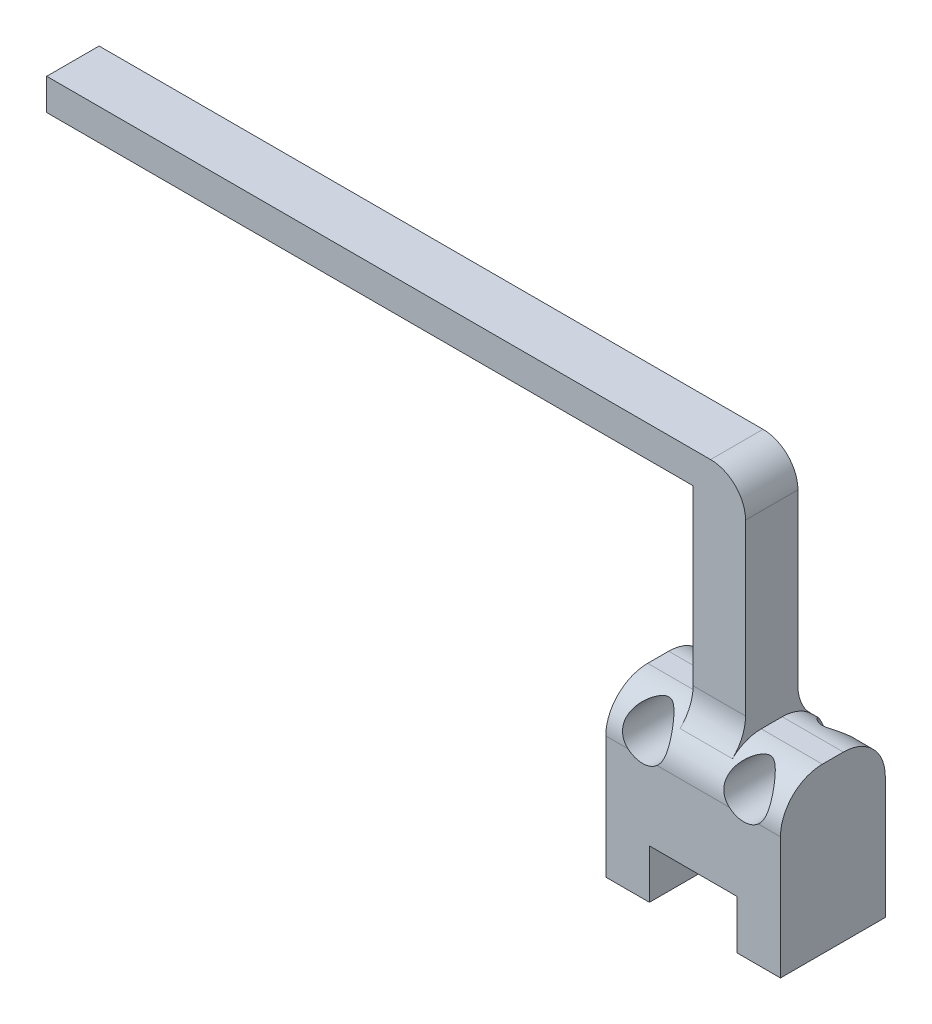
from build123d import *

# Parameters (mm, degrees)
SKETCH1_R           = 3.175
PUSHER_BASE_DEPTH   = 15
SKETCH3_R           = 1.95
SCREW_HOLE_DEPTH    = 7.5
SKETCH6_W           = 7.5
SKETCH6_H           = 32
PUSHER_HEAD_DEPTH   = 3.75
FILLET1_R           = 6
FILLET5_R           = 6
FILLET6_R           = 6
SKETCH8_W           = 92.5
SKETCH8_H           = 4.5
BOSS_EXTRUDE1_DEPTH = 7.5
FILLET7_R           = 5


with BuildPart() as part:
    # Sketch1 → pusher base (new body)
    with BuildSketch(Plane.XY):
        Polygon((59.166899441, -45.781018283), (51.666899441, -45.781018283), (41.666899441, -45.781018283), (34.166899441, -45.781018283), (34.166899441, -69.281018283), (40.416899441, -69.281018283), (40.416899441, -62.281018283), (52.916899441, -62.281018283), (52.916899441, -69.281018283), (59.166899441, -69.281018283), align=None)
        with Locations((39.416899441, -49.381018283)):
            Circle(SKETCH1_R, mode=Mode.SUBTRACT)
        with Locations((53.916899441, -49.381018283)):
            Circle(SKETCH1_R, mode=Mode.SUBTRACT)
    extrude(amount=PUSHER_BASE_DEPTH)

    # Sketch3 → screw hole (cut)
    with BuildSketch(Plane.XZ.offset(62.281018283)):
        with Locations(Location((46.666899441, 7.5, 0), (0, 0, 270))):
            Circle(SKETCH3_R)
    extrude(amount=-SCREW_HOLE_DEPTH, mode=Mode.SUBTRACT)

    # Sketch6 → pusher head (add, symmetric)
    with BuildSketch(Plane.XY.offset(7.5)):
        with Locations((46.666899441, -29.781018283)):
            Rectangle(SKETCH6_W, SKETCH6_H)
    extrude(amount=PUSHER_HEAD_DEPTH, both=True)

    # Fillet1
    # the kernel refuses this fillet: 6 mm, written as the material it takes off along each edge
    with BuildSketch(Plane(origin=(74.166899441, -45.781018283, 0), x_dir=(0, 0, 1), z_dir=(-1, 0, 0))) as fillet1_piece_1_section:
        with BuildLine():
            CenterArc((FILLET1_R, -FILLET1_R), FILLET1_R, 90, 90)
            Line((0, -FILLET1_R), (0, 0))
            Line((0, 0), (FILLET1_R, 0))
        make_face()
    fillet1_piece_1 = extrude(amount=55, mode=Mode.PRIVATE)
    fillet1_piece_1 = split(fillet1_piece_1, bisect_by=Plane(origin=(62.291899441, -45.824840722, 3.75), z_dir=(0, 0, 1)), keep=Keep.TOP, mode=Mode.PRIVATE)
    fillet1_piece_1 = split(fillet1_piece_1, bisect_by=Plane(origin=(50.416899441, -45.824840722, 4.566140917), z_dir=(1, 0, 0)), keep=Keep.TOP, mode=Mode.PRIVATE)
    add(fillet1_piece_1, mode=Mode.SUBTRACT)
    with BuildSketch(Plane(origin=(74.166899441, -45.781018283, 0), x_dir=(0, 0, 1), z_dir=(-1, 0, 0))) as fillet1_piece_2_section:
        with BuildLine():
            CenterArc((FILLET1_R, -FILLET1_R), FILLET1_R, 90, 90)
            Line((0, -FILLET1_R), (0, 0))
            Line((0, 0), (FILLET1_R, 0))
        make_face()
    fillet1_piece_2 = extrude(amount=55, mode=Mode.PRIVATE)
    fillet1_piece_2 = split(fillet1_piece_2, bisect_by=Plane(origin=(62.291899441, -47.230240291, 3.75), z_dir=(0, 0, -1)), keep=Keep.TOP, mode=Mode.PRIVATE)
    fillet1_piece_2 = split(fillet1_piece_2, bisect_by=Plane(origin=(50.416899441, -47.230240291, 1.136674626), z_dir=(1, 0, 0)), keep=Keep.TOP, mode=Mode.PRIVATE)
    add(fillet1_piece_2, mode=Mode.SUBTRACT)
    with BuildSketch(Plane(origin=(74.166899441, -45.781018283, 0), x_dir=(0, 0, 1), z_dir=(-1, 0, 0))) as fillet1_piece_3_section:
        with BuildLine():
            CenterArc((FILLET1_R, -FILLET1_R), FILLET1_R, 90, 90)
            Line((0, -FILLET1_R), (0, 0))
            Line((0, 0), (FILLET1_R, 0))
        make_face()
    fillet1_piece_3 = extrude(amount=55, mode=Mode.PRIVATE)
    fillet1_piece_3 = split(fillet1_piece_3, bisect_by=Plane(origin=(46.666899441, -47.230240291, 3.75), z_dir=(0, 0, -1)), keep=Keep.TOP, mode=Mode.PRIVATE)
    fillet1_piece_3 = split(fillet1_piece_3, bisect_by=Plane(origin=(50.416899441, -47.230240291, 1.136674626), z_dir=(-1, 0, 0)), keep=Keep.TOP, mode=Mode.PRIVATE)
    fillet1_piece_3 = split(fillet1_piece_3, bisect_by=Plane(origin=(42.916899441, -47.230240291, 1.136674626), z_dir=(1, 0, 0)), keep=Keep.TOP, mode=Mode.PRIVATE)
    add(fillet1_piece_3, mode=Mode.SUBTRACT)
    with BuildSketch(Plane(origin=(74.166899441, -45.781018283, 0), x_dir=(0, 0, 1), z_dir=(-1, 0, 0))) as fillet1_piece_4_section:
        with BuildLine():
            CenterArc((FILLET1_R, -FILLET1_R), FILLET1_R, 90, 90)
            Line((0, -FILLET1_R), (0, 0))
            Line((0, 0), (FILLET1_R, 0))
        make_face()
    fillet1_piece_4 = extrude(amount=55, mode=Mode.PRIVATE)
    fillet1_piece_4 = split(fillet1_piece_4, bisect_by=Plane(origin=(31.041899441, -45.824840722, 3.75), z_dir=(0, 0, 1)), keep=Keep.TOP, mode=Mode.PRIVATE)
    fillet1_piece_4 = split(fillet1_piece_4, bisect_by=Plane(origin=(42.916899441, -45.824840722, 4.566140917), z_dir=(-1, 0, 0)), keep=Keep.TOP, mode=Mode.PRIVATE)
    add(fillet1_piece_4, mode=Mode.SUBTRACT)
    with BuildSketch(Plane(origin=(74.166899441, -45.781018283, 0), x_dir=(0, 0, 1), z_dir=(-1, 0, 0))) as fillet1_piece_5_section:
        with BuildLine():
            CenterArc((FILLET1_R, -FILLET1_R), FILLET1_R, 90, 90)
            Line((0, -FILLET1_R), (0, 0))
            Line((0, 0), (FILLET1_R, 0))
        make_face()
    fillet1_piece_5 = extrude(amount=55, mode=Mode.PRIVATE)
    fillet1_piece_5 = split(fillet1_piece_5, bisect_by=Plane(origin=(31.041899441, -47.230240291, 3.75), z_dir=(0, 0, -1)), keep=Keep.TOP, mode=Mode.PRIVATE)
    fillet1_piece_5 = split(fillet1_piece_5, bisect_by=Plane(origin=(42.916899441, -47.230240291, 1.136674626), z_dir=(-1, 0, 0)), keep=Keep.TOP, mode=Mode.PRIVATE)
    add(fillet1_piece_5, mode=Mode.SUBTRACT)
    with BuildSketch(Plane(origin=(19.166899441, -45.781018283, 15), x_dir=(0, 0, -1), z_dir=(1, 0, 0))) as fillet1_piece_6_section:
        with BuildLine():
            CenterArc((FILLET1_R, -FILLET1_R), FILLET1_R, 90, 90)
            Line((0, -FILLET1_R), (0, 0))
            Line((0, 0), (FILLET1_R, 0))
        make_face()
    fillet1_piece_6 = extrude(amount=55, mode=Mode.PRIVATE)
    fillet1_piece_6 = split(fillet1_piece_6, bisect_by=Plane(origin=(31.041899441, -45.824840722, 11.25), z_dir=(0, 0, -1)), keep=Keep.TOP, mode=Mode.PRIVATE)
    fillet1_piece_6 = split(fillet1_piece_6, bisect_by=Plane(origin=(42.916899441, -45.824840722, 10.433859083), z_dir=(-1, 0, 0)), keep=Keep.TOP, mode=Mode.PRIVATE)
    add(fillet1_piece_6, mode=Mode.SUBTRACT)
    with BuildSketch(Plane(origin=(19.166899441, -45.781018283, 15), x_dir=(0, 0, -1), z_dir=(1, 0, 0))) as fillet1_piece_7_section:
        with BuildLine():
            CenterArc((FILLET1_R, -FILLET1_R), FILLET1_R, 90, 90)
            Line((0, -FILLET1_R), (0, 0))
            Line((0, 0), (FILLET1_R, 0))
        make_face()
    fillet1_piece_7 = extrude(amount=55, mode=Mode.PRIVATE)
    fillet1_piece_7 = split(fillet1_piece_7, bisect_by=Plane(origin=(31.041899441, -47.230240291, 11.25), z_dir=(0, 0, 1)), keep=Keep.TOP, mode=Mode.PRIVATE)
    fillet1_piece_7 = split(fillet1_piece_7, bisect_by=Plane(origin=(42.916899441, -47.230240291, 13.863325374), z_dir=(-1, 0, 0)), keep=Keep.TOP, mode=Mode.PRIVATE)
    add(fillet1_piece_7, mode=Mode.SUBTRACT)
    with BuildSketch(Plane(origin=(19.166899441, -45.781018283, 15), x_dir=(0, 0, -1), z_dir=(1, 0, 0))) as fillet1_piece_8_section:
        with BuildLine():
            CenterArc((FILLET1_R, -FILLET1_R), FILLET1_R, 90, 90)
            Line((0, -FILLET1_R), (0, 0))
            Line((0, 0), (FILLET1_R, 0))
        make_face()
    fillet1_piece_8 = extrude(amount=55, mode=Mode.PRIVATE)
    fillet1_piece_8 = split(fillet1_piece_8, bisect_by=Plane(origin=(50.416899441, -47.230240291, 13.863325374), z_dir=(-1, 0, 0)), keep=Keep.TOP, mode=Mode.PRIVATE)
    fillet1_piece_8 = split(fillet1_piece_8, bisect_by=Plane(origin=(46.666899441, -47.230240291, 11.25), z_dir=(0, 0, 1)), keep=Keep.TOP, mode=Mode.PRIVATE)
    fillet1_piece_8 = split(fillet1_piece_8, bisect_by=Plane(origin=(42.916899441, -47.230240291, 13.863325374), z_dir=(1, 0, 0)), keep=Keep.TOP, mode=Mode.PRIVATE)
    add(fillet1_piece_8, mode=Mode.SUBTRACT)
    with BuildSketch(Plane(origin=(19.166899441, -45.781018283, 15), x_dir=(0, 0, -1), z_dir=(1, 0, 0))) as fillet1_piece_9_section:
        with BuildLine():
            CenterArc((FILLET1_R, -FILLET1_R), FILLET1_R, 90, 90)
            Line((0, -FILLET1_R), (0, 0))
            Line((0, 0), (FILLET1_R, 0))
        make_face()
    fillet1_piece_9 = extrude(amount=55, mode=Mode.PRIVATE)
    fillet1_piece_9 = split(fillet1_piece_9, bisect_by=Plane(origin=(50.416899441, -45.824840722, 10.433859083), z_dir=(1, 0, 0)), keep=Keep.TOP, mode=Mode.PRIVATE)
    fillet1_piece_9 = split(fillet1_piece_9, bisect_by=Plane(origin=(62.291899441, -45.824840722, 11.25), z_dir=(0, 0, -1)), keep=Keep.TOP, mode=Mode.PRIVATE)
    add(fillet1_piece_9, mode=Mode.SUBTRACT)
    with BuildSketch(Plane(origin=(19.166899441, -45.781018283, 15), x_dir=(0, 0, -1), z_dir=(1, 0, 0))) as fillet1_piece_10_section:
        with BuildLine():
            CenterArc((FILLET1_R, -FILLET1_R), FILLET1_R, 90, 90)
            Line((0, -FILLET1_R), (0, 0))
            Line((0, 0), (FILLET1_R, 0))
        make_face()
    fillet1_piece_10 = extrude(amount=55, mode=Mode.PRIVATE)
    fillet1_piece_10 = split(fillet1_piece_10, bisect_by=Plane(origin=(50.416899441, -47.230240291, 13.863325374), z_dir=(1, 0, 0)), keep=Keep.TOP, mode=Mode.PRIVATE)
    fillet1_piece_10 = split(fillet1_piece_10, bisect_by=Plane(origin=(62.291899441, -47.230240291, 11.25), z_dir=(0, 0, 1)), keep=Keep.TOP, mode=Mode.PRIVATE)
    add(fillet1_piece_10, mode=Mode.SUBTRACT)

    # Fillet5
    fillet5_edges = [part.edges().sort_by_distance(p)[0] for p in [
        (46.666899441, -46.218869418, 11.25),
    ]]
    fillet(fillet5_edges, radius=FILLET5_R)

    # Fillet6
    fillet6_edges = [part.edges().sort_by_distance(p)[0] for p in [
        (46.666899441, -46.218869418, 3.75),
    ]]
    fillet(fillet6_edges, radius=FILLET6_R)

    # Sketch8 → Boss-Extrude1 (add)
    with BuildSketch(Plane(origin=(0, 0, 3.75), x_dir=(-1, 0, 0), z_dir=(0, 0, -1))):
        with Locations((3.333100559, -16.031018283)):
            Rectangle(SKETCH8_W, SKETCH8_H)
    extrude(amount=-BOSS_EXTRUDE1_DEPTH)

    # Fillet7
    fillet7_edges = [part.edges().sort_by_distance(p)[0] for p in [
        (50.416899441, -13.781018283, 7.5),
    ]]
    fillet(fillet7_edges, radius=FILLET7_R)


solid = part.part
